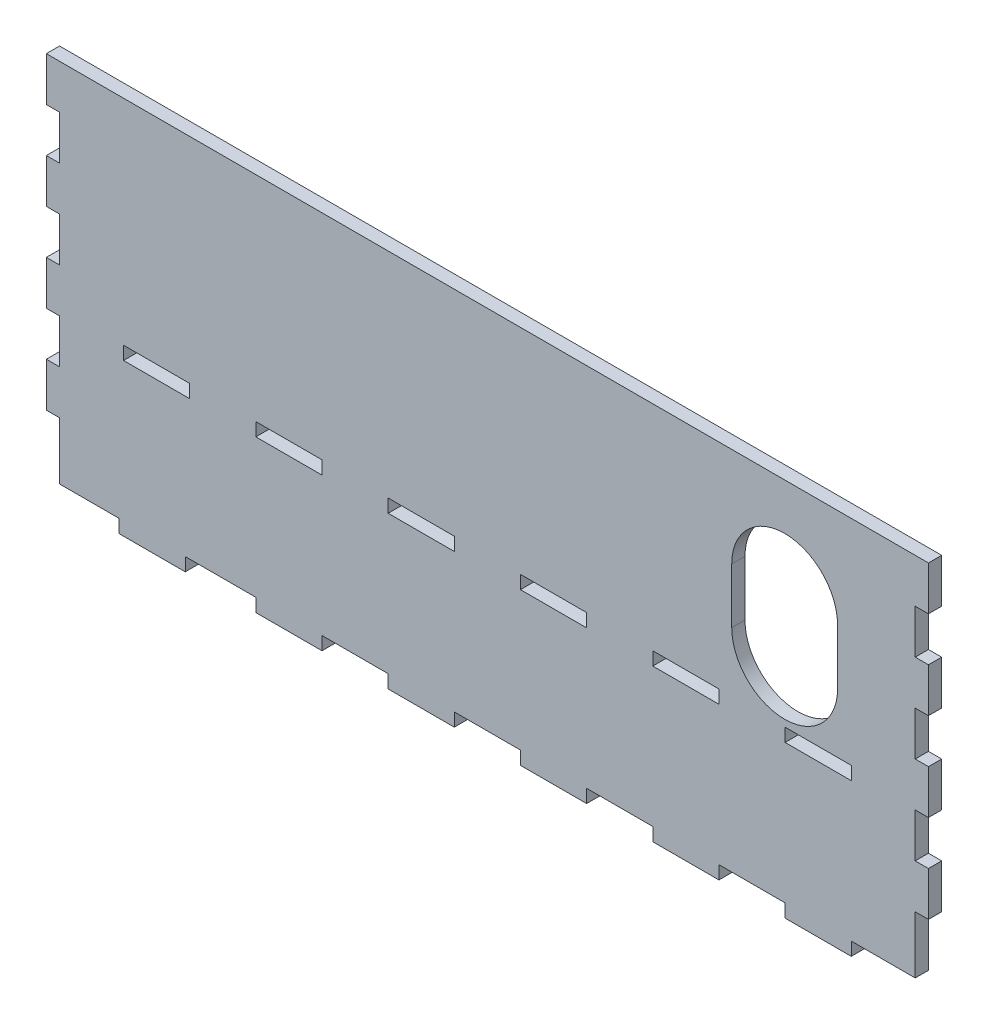
from build123d import *

# Parameters (mm, degrees)
BOSS_EXTRUDE1_DEPTH = 3
SKETCH2_W           = 15
SKETCH2_H           = 3
CUT_EXTRUDE1_DEPTH  = 10


with BuildPart() as part:
    # Sketch1 → Boss-Extrude1 (new body)
    with BuildSketch(Plane.XY):
        Polygon((-97, -12.5), (-97, -25.5), (-83.5, -25.5), (-83.5, -28.5), (-68.5, -28.5), (-68.5, -25.5), (-52.5, -25.5), (-52.5, -28.5), (-37.5, -28.5), (-37.5, -25.5), (-22.5, -25.5), (-22.5, -28.5), (-7.5, -28.5), (-7.5, -25.5), (0, -25.5), (7.5, -25.5), (7.5, -28.5), (22.5, -28.5), (22.5, -25.5), (30, -25.5), (37.5, -25.5), (37.5, -28.5), (52.5, -28.5), (52.5, -25.5), (60, -25.5), (67.5, -25.5), (67.5, -28.5), (82.5, -28.5), (82.5, -25.5), (97, -25.5), (97, -12.5), (100, -12.5), (100, -2.5), (97, -2.5), (97, 7.5), (100, 7.5), (100, 17.5), (97, 17.5), (97, 27.5), (100, 27.5), (100, 37.5), (97, 37.5), (97, 47.5), (100, 47.5), (100, 57.5), (97, 57.5), (-97, 57.5), (-100, 57.5), (-100, 47.5), (-97, 47.5), (-97, 37.5), (-100, 37.5), (-100, 27.5), (-97, 27.5), (-97, 17.5), (-100, 17.5), (-100, 7.5), (-97, 7.5), (-97, -2.5), (-100, -2.5), (-100, -12.5), align=None)
    extrude(amount=BOSS_EXTRUDE1_DEPTH)

    # Sketch2 → Cut-Extrude1 (cut)
    with BuildSketch(Plane.XY.offset(3)):
        with BuildLine():
            Line((55.4, 22.5), (55.4, 35))
            ThreePointArc((55.4, 35), (67.4, 47), (79.4, 35))
            Line((79.4, 35), (79.4, 22.5))
            ThreePointArc((79.4, 22.5), (67.4, 10.5), (55.4, 22.5))
        make_face()
        with Locations((15, 7.5)):
            Rectangle(SKETCH2_W, SKETCH2_H)
        with Locations((45, 7.5)):
            Rectangle(SKETCH2_W, SKETCH2_H)
        with Locations((75, 7.5)):
            Rectangle(SKETCH2_W, SKETCH2_H)
        with Locations((-75, 7.5)):
            Rectangle(SKETCH2_W, SKETCH2_H)
        with Locations((-45, 7.5)):
            Rectangle(SKETCH2_W, SKETCH2_H)
        with Locations((-15, 7.5)):
            Rectangle(SKETCH2_W, SKETCH2_H)
    extrude(amount=-CUT_EXTRUDE1_DEPTH, mode=Mode.SUBTRACT)


solid = part.part
